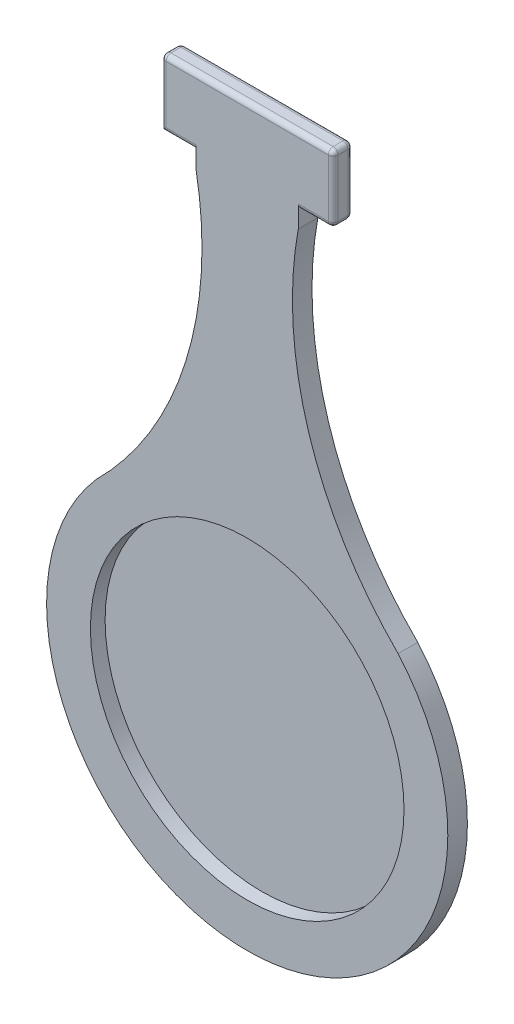
from build123d import *

# Parameters (mm, degrees)
EXTRUDE_2_DEPTH     = 4
SKETCH_5_R          = 32
CUT_EXTRUDE_2_DEPTH = 3
FILLET_7_R          = 1
FILLET_8_R          = 1


with BuildPart() as part:
    # 草图4 → 凸台-拉伸2 (new body)
    with BuildSketch(Plane.XY):
        with BuildLine():
            Line((10.426433706, 95.258075622), (17.547383854, 95.258075622))
            Line((17.547383854, 95.258075622), (17.547383854, 108.961036928))
            Line((17.547383854, 108.961036928), (-17.547383854, 108.961036928))
            Line((-17.547383854, 108.961036928), (-17.547383854, 95.258075622))
            Line((-17.547383854, 95.258075622), (-10.426433706, 95.258075622))
            Line((-10.426433706, 95.258075622), (-10.426433706, 91.831524795))
            ThreePointArc((-10.426433706, 91.831524795), (-12.565979517, 56.877826167), (-30.794002854, 26.976691251))
            ThreePointArc((-30.794002854, 26.976691251), (0, -40.939131434), (30.794002854, 26.976691251))
            ThreePointArc((30.794002854, 26.976691251), (12.565979517, 56.877826167), (10.426433706, 91.831524795))
            Line((10.426433706, 91.831524795), (10.426433706, 95.258075622))
        make_face()
    extrude(amount=EXTRUDE_2_DEPTH)

    # 草图5 → 切除-拉伸2 (cut)
    with BuildSketch(Plane.XY.offset(4)):
        Circle(SKETCH_5_R)
    extrude(amount=-CUT_EXTRUDE_2_DEPTH, mode=Mode.SUBTRACT)

    # 圆角7
    fillet_7_edges = [part.edges().sort_by_distance(p)[0] for p in [
        (-13.98690878, 95.258075622, 0),
        (-17.547383854, 102.109556275, 0),
        (0, 108.961036928, 0),
        (17.547383854, 102.109556275, 0),
        (13.98690878, 95.258075622, 4),
        (13.98690878, 95.258075622, 0),
        (17.547383854, 102.109556275, 4),
        (17.547383854, 95.258075622, 2),
        (0, 108.961036928, 4),
        (-17.547383854, 102.109556275, 4),
        (-13.98690878, 95.258075622, 4),
    ]]
    fillet(fillet_7_edges, radius=FILLET_7_R)

    # 圆角8
    # the kernel refuses this fillet: 1 mm, written as the material it takes off along each edge
    with BuildSketch(Plane(origin=(-16.547383854, 107.961036928, 1), x_dir=(0, 1, 0), z_dir=(-1, 0, 0))) as fillet_8_piece_1_section:
        Polygon((0, 0), (FILLET_8_R, 0), (FILLET_8_R, FILLET_8_R), (0, FILLET_8_R), align=None)
    fillet_8_piece_1 = extrude(amount=FILLET_8_R, mode=Mode.PRIVATE)
    fillet_8_piece_1 = fillet_8_piece_1 - Plane(origin=(-16.547383854, 107.961036928, 1), x_dir=(0, -0.7071067811865475, 0.7071067811865475), z_dir=(-1, 0, 0)) * Sphere(FILLET_8_R, mode=Mode.PRIVATE)
    add(fillet_8_piece_1, mode=Mode.SUBTRACT)
    with BuildSketch(Plane(origin=(16.547383854, 107.961036928, 1), x_dir=(0, 1, 0), z_dir=(1, 0, 0))) as fillet_8_piece_2_section:
        Polygon((0, 0), (FILLET_8_R, 0), (FILLET_8_R, -FILLET_8_R), (0, -FILLET_8_R), align=None)
    fillet_8_piece_2 = extrude(amount=FILLET_8_R, mode=Mode.PRIVATE)
    fillet_8_piece_2 = fillet_8_piece_2 - Plane(origin=(16.547383854, 107.961036928, 1), x_dir=(0, -0.7071067811865475, 0.7071067811865475), z_dir=(1, 0, 0)) * Sphere(FILLET_8_R, mode=Mode.PRIVATE)
    add(fillet_8_piece_2, mode=Mode.SUBTRACT)
    with BuildSketch(Plane(origin=(16.547383854, 107.961036928, 3), x_dir=(0, 1, 0), z_dir=(1, 0, 0))) as fillet_8_piece_3_section:
        Polygon((0, 0), (FILLET_8_R, 0), (FILLET_8_R, FILLET_8_R), (0, FILLET_8_R), align=None)
    fillet_8_piece_3 = extrude(amount=FILLET_8_R, mode=Mode.PRIVATE)
    fillet_8_piece_3 = fillet_8_piece_3 - Plane(origin=(16.547383854, 107.961036928, 3), x_dir=(0, -0.7071067811865475, -0.7071067811865475), z_dir=(1, 0, 0)) * Sphere(FILLET_8_R, mode=Mode.PRIVATE)
    add(fillet_8_piece_3, mode=Mode.SUBTRACT)
    with BuildSketch(Plane(origin=(-16.547383854, 107.961036928, 3), x_dir=(0, 1, 0), z_dir=(-1, 0, 0))) as fillet_8_piece_4_section:
        Polygon((0, 0), (FILLET_8_R, 0), (FILLET_8_R, -FILLET_8_R), (0, -FILLET_8_R), align=None)
    fillet_8_piece_4 = extrude(amount=FILLET_8_R, mode=Mode.PRIVATE)
    fillet_8_piece_4 = fillet_8_piece_4 - Plane(origin=(-16.547383854, 107.961036928, 3), x_dir=(0, -0.7071067811865475, -0.7071067811865475), z_dir=(-1, 0, 0)) * Sphere(FILLET_8_R, mode=Mode.PRIVATE)
    add(fillet_8_piece_4, mode=Mode.SUBTRACT)
    with BuildSketch(Plane(origin=(-17.547383854, 108.961036928, 1), x_dir=(0, -1, 0), z_dir=(0, 0, 1))) as fillet_8_piece_5:
        with BuildLine():
            CenterArc((FILLET_8_R, FILLET_8_R), FILLET_8_R, 180, 90)
            Line((0, FILLET_8_R), (0, 0))
            Line((0, 0), (FILLET_8_R, 0))
        make_face()
    extrude(amount=2, mode=Mode.SUBTRACT)
    with BuildSketch(Plane(origin=(17.547383854, 108.961036928, 1), x_dir=(0, -1, 0), z_dir=(0, 0, 1))) as fillet_8_piece_6:
        with BuildLine():
            CenterArc((FILLET_8_R, -FILLET_8_R), FILLET_8_R, 90, 90)
            Line((0, -FILLET_8_R), (0, 0))
            Line((0, 0), (FILLET_8_R, 0))
        make_face()
    extrude(amount=2, mode=Mode.SUBTRACT)


solid = part.part
